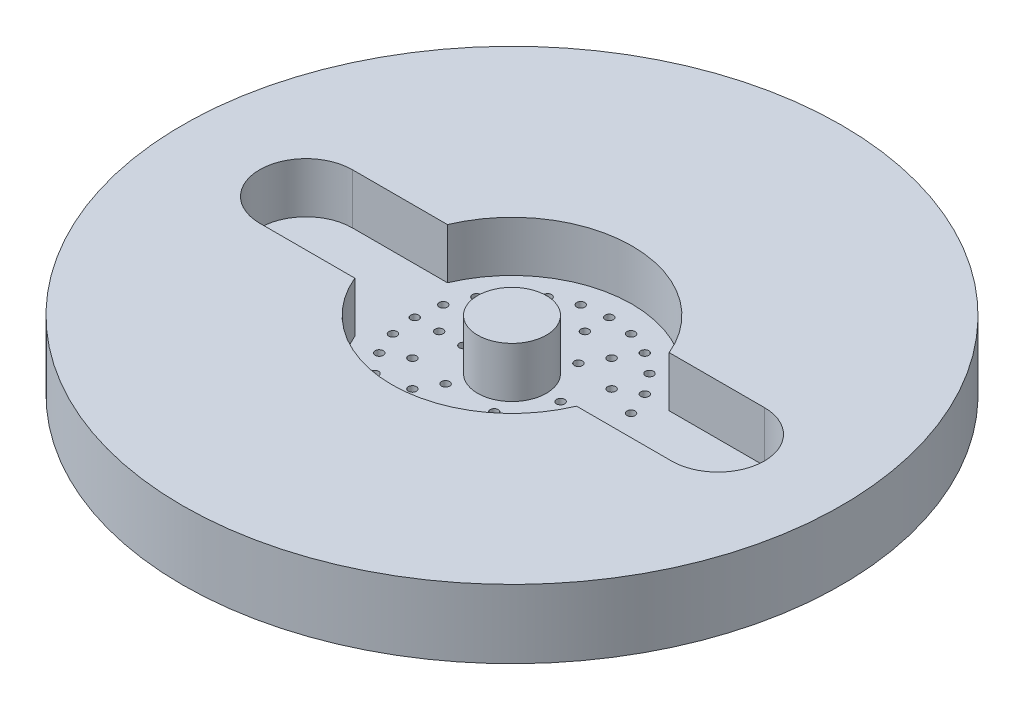
from build123d import *

# Parameters (mm, degrees)
SKETCH1_R                       = 60.96
BILLET_DEPTH                    = 12.7
SKETCH4_R                       = 0.7493
FIRST_KEROSENE_OUTLET_DEPTH     = 88.140881336
PRIMARY_HOLES_COUNT             = 6
SECOND_START                    = -12.7
SECOND_RING_OUTLINE_R           = 0.7493
SECOND_RING_DEPTH               = 12.7
THIRD_START                     = -12.7
THIRD_RING_OUTLINE_R            = 0.7493
THIRD_RING_DEPTH                = 12.7
KEROSENE_WELL_DEPTH             = 9.3218
SKETCH17_R                      = 6.35
BOSS_EXTRUDE1_DEPTH             = 2.54
BOSS_EXTRUDE1_DIRECTION_2_REACH = 89.141
SKETCH19_R                      = 6.35
LOX_TOWER_DEPTH                 = 2.54


# Read off the part's stored shape, not the designer's step: Second ring, Third Ring
with BuildPart() as part:
    # Sketch1 → Billet (new body)
    with BuildSketch(Plane(origin=(0, 0, 0), x_dir=(1, 0, 0), z_dir=(0, 1, 0))):
        with Locations(Location((0, 0, 0), (0, 0, 270))):
            Circle(SKETCH1_R)
    extrude(amount=-BILLET_DEPTH)

    # Sketch4 → First Kerosene Outlet (cut, symmetric)
    with BuildSketch(Plane(origin=(0, -12.7, 0), x_dir=(1, 0, 0), z_dir=(0, 1, 0))):
        with Locations(Location((8.9916, 0, 0), (0, 0, 270))):
            Circle(SKETCH4_R)
        with Locations(Location((13.4874, 0, 0), (0, 0, 270))):
            Circle(SKETCH4_R)
        with Locations(Location((17.9832, 0, 0), (0, 0, 270))):
            Circle(SKETCH4_R)
    first_kerosene_outlet = extrude(amount=FIRST_KEROSENE_OUTLET_DEPTH, both=True, mode=Mode.SUBTRACT)

    # Primary Holes: First Kerosene Outlet ×6 about axis
    primary_holes_axis = Axis((0, 0, 0), (0, 1, 0))
    for i in range(1, PRIMARY_HOLES_COUNT):
        add(first_kerosene_outlet.rotate(primary_holes_axis, i * 360 / PRIMARY_HOLES_COUNT), mode=Mode.SUBTRACT)

    # Second ring outline → Second ring (cut)
    with BuildSketch(Plane(origin=(0, 0, 0), x_dir=(1, 0, 0), z_dir=(0, 1, 0)).offset(SECOND_START)):
        with Locations((11.680431031, 6.7437)):
            Circle(SECOND_RING_OUTLINE_R)
        with Locations((0, 13.4874)):
            Circle(SECOND_RING_OUTLINE_R)
        with Locations((-11.680431031, 6.7437)):
            Circle(SECOND_RING_OUTLINE_R)
        with Locations((-11.680431031, -6.7437)):
            Circle(SECOND_RING_OUTLINE_R)
        with Locations((0, -13.4874)):
            Circle(SECOND_RING_OUTLINE_R)
        with Locations((11.680431031, -6.7437)):
            Circle(SECOND_RING_OUTLINE_R)
    extrude(amount=SECOND_RING_DEPTH, mode=Mode.SUBTRACT)

    # Third Ring outline → Third Ring (cut)
    with BuildSketch(Plane(origin=(0, 0, 0), x_dir=(1, 0, 0), z_dir=(0, 1, 0)).offset(THIRD_START)):
        with Locations((17.370437319, 4.654394652)):
            Circle(THIRD_RING_OUTLINE_R)
        with Locations((15.573908041, 8.9916)):
            Circle(THIRD_RING_OUTLINE_R)
        with Locations((12.716042667, 12.716042667)):
            Circle(THIRD_RING_OUTLINE_R)
        with Locations((4.654394652, 17.370437319)):
            Circle(THIRD_RING_OUTLINE_R)
        with Locations((0, 17.9832)):
            Circle(THIRD_RING_OUTLINE_R)
        with Locations((-4.654394652, 17.370437319)):
            Circle(THIRD_RING_OUTLINE_R)
        with Locations((-12.716042667, 12.716042667)):
            Circle(THIRD_RING_OUTLINE_R)
        with Locations((-15.573908041, 8.9916)):
            Circle(THIRD_RING_OUTLINE_R)
        with Locations((-17.370437319, 4.654394652)):
            Circle(THIRD_RING_OUTLINE_R)
        with Locations((-17.370437319, -4.654394652)):
            Circle(THIRD_RING_OUTLINE_R)
        with Locations((-15.573908041, -8.9916)):
            Circle(THIRD_RING_OUTLINE_R)
        with Locations((-12.716042667, -12.716042667)):
            Circle(THIRD_RING_OUTLINE_R)
        with Locations((-4.654394652, -17.370437319)):
            Circle(THIRD_RING_OUTLINE_R)
        with Locations((0, -17.9832)):
            Circle(THIRD_RING_OUTLINE_R)
        with Locations((4.654394652, -17.370437319)):
            Circle(THIRD_RING_OUTLINE_R)
        with Locations((12.716042667, -12.716042667)):
            Circle(THIRD_RING_OUTLINE_R)
        with Locations((15.573908041, -8.9916)):
            Circle(THIRD_RING_OUTLINE_R)
        with Locations((17.370437319, -4.654394652)):
            Circle(THIRD_RING_OUTLINE_R)
    extrude(amount=THIRD_RING_DEPTH, mode=Mode.SUBTRACT)

    # Sketch18 → Kerosene Well (cut)
    with BuildSketch(Plane(origin=(0, 0, 0), x_dir=(1, 0, 0), z_dir=(0, 1, 0))):
        with BuildLine():
            Line((-38.1, 8.57504), (-20.504129194, 8.57504))
            ThreePointArc((-20.504129194, 8.57504), (0, 22.225), (20.504129194, 8.57504))
            Line((20.504129194, 8.57504), (38.1, 8.57504))
            ThreePointArc((38.1, 8.57504), (46.67504, 0), (38.1, -8.57504))
            Line((38.1, -8.57504), (20.504129194, -8.57504))
            ThreePointArc((20.504129194, -8.57504), (0, -22.225), (-20.504129194, -8.57504))
            Line((-20.504129194, -8.57504), (-38.1, -8.57504))
            ThreePointArc((-38.1, -8.57504), (-46.67504, 0), (-38.1, 8.57504))
        make_face()
    extrude(amount=-KEROSENE_WELL_DEPTH, mode=Mode.SUBTRACT)

    # Sketch17 → Boss-Extrude1 (add)
    with BuildSketch(Plane(origin=(0, 0, 0), x_dir=(1, 0, 0), z_dir=(0, 1, 0))):
        with Locations(Location((0, 0, 0), (0, 0, 270))):
            Circle(SKETCH17_R)
    extrude(amount=BOSS_EXTRUDE1_DEPTH)

    # Sketch17 → Boss-Extrude1 direction 2 (add, up to next)
    with BuildSketch(Plane(origin=(0, 0, 0), x_dir=(1, 0, 0), z_dir=(0, 1, 0)), mode=Mode.PRIVATE) as boss_extrude1_direction_2_sk1:
        with Locations(Location((0, 0, 0), (0, 0, 270))):
            Circle(SKETCH17_R)
    boss_extrude1_direction_2_tool1 = extrude(boss_extrude1_direction_2_sk1.sketch, amount=-BOSS_EXTRUDE1_DIRECTION_2_REACH, mode=Mode.PRIVATE) - part.part
    add(boss_extrude1_direction_2_tool1.solids().sort_by_distance((0, 0, 0))[0])

    # Sketch19 → Lox Tower (cut)
    with BuildSketch(Plane(origin=(0, 2.54, 0), x_dir=(1, 0, 0), z_dir=(0, 1, 0))):
        with Locations(Location((0, 0, 0), (0, 0, 270))):
            Circle(SKETCH19_R)
    extrude(amount=-LOX_TOWER_DEPTH, mode=Mode.SUBTRACT)


solid = part.part
